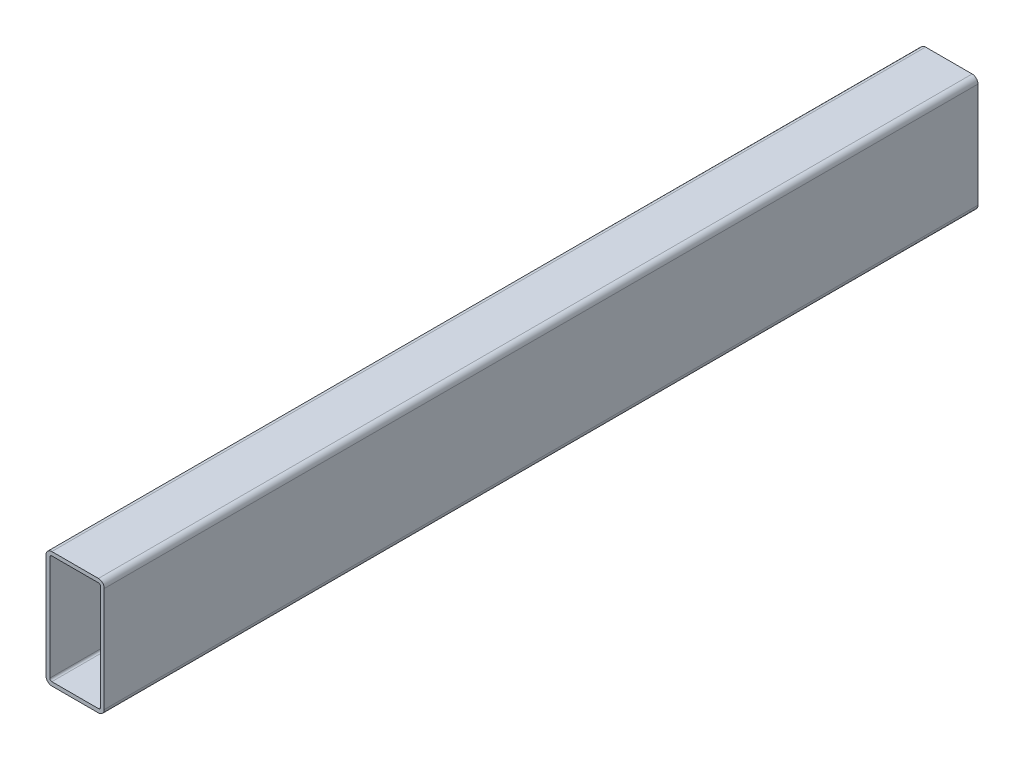
from build123d import *

# Parameters (mm, degrees)
EXTRUDE_THIN1_DEPTH = 381


with BuildPart() as part:
    # Sketch1 → Extrude-Thin1 (new body)
    with BuildSketch(Plane.XY):
        with BuildLine():
            Line((-10.16, 25.4), (10.16, 25.4))
            ThreePointArc((10.16, 25.4), (11.956051224, 24.656051224), (12.7, 22.86))
            Line((12.7, 22.86), (12.7, -22.86))
            ThreePointArc((12.7, -22.86), (11.956051224, -24.656051224), (10.16, -25.4))
            Line((10.16, -25.4), (-10.16, -25.4))
            ThreePointArc((-10.16, -25.4), (-11.956051224, -24.656051224), (-12.7, -22.86))
            Line((-12.7, -22.86), (-12.7, 22.86))
            ThreePointArc((-12.7, 22.86), (-11.956051224, 24.656051224), (-10.16, 25.4))
        make_face()
        with BuildLine():
            Line((-10.16, 23.749), (10.16, 23.749))
            ThreePointArc((10.16, 23.749), (10.788617928, 23.488617928), (11.049, 22.86))
            Line((11.049, 22.86), (11.049, -22.86))
            ThreePointArc((11.049, -22.86), (10.788617928, -23.488617928), (10.16, -23.749))
            Line((10.16, -23.749), (-10.16, -23.749))
            ThreePointArc((-10.16, -23.749), (-10.788617928, -23.488617928), (-11.049, -22.86))
            Line((-11.049, -22.86), (-11.049, 22.86))
            ThreePointArc((-11.049, 22.86), (-10.788617928, 23.488617928), (-10.16, 23.749))
        make_face(mode=Mode.SUBTRACT)
    extrude(amount=EXTRUDE_THIN1_DEPTH)


solid = part.part
